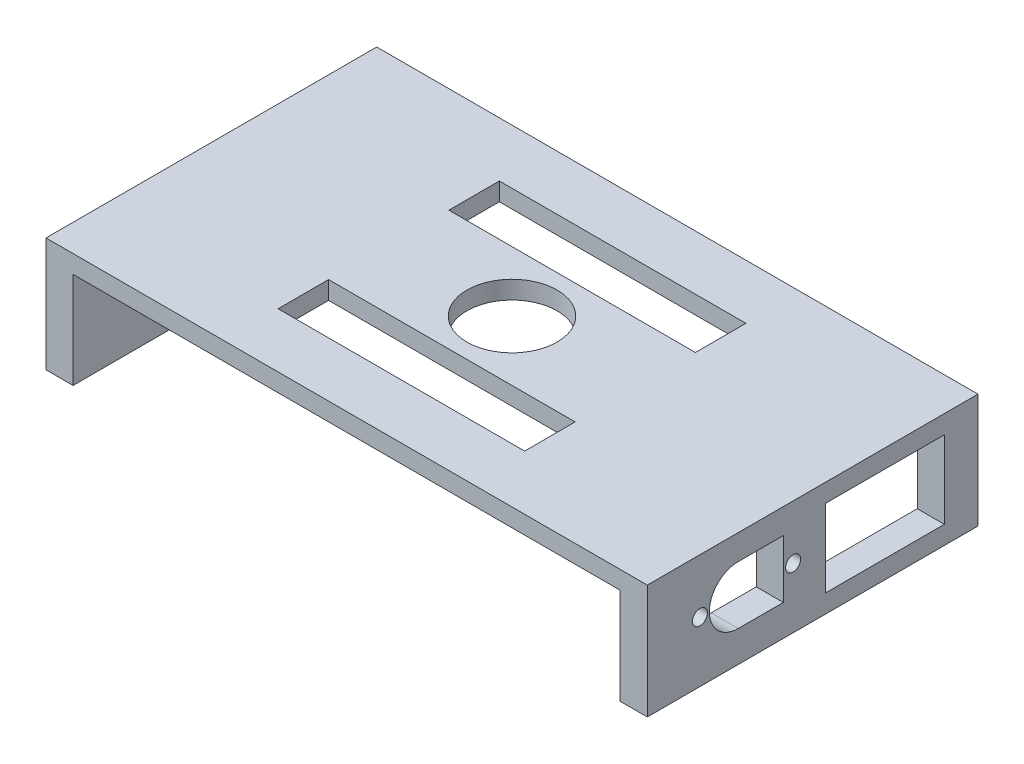
from build123d import *

# Parameters (mm, degrees)
SKETCH1_W           = 100
SKETCH1_H           = 55
BOSS_EXTRUDE1_DEPTH = 19
SKETCH2_W           = 91
SKETCH2_H           = 91
CUT_EXTRUDE1_DEPTH  = 16
CUT_EXTRUDE3_REACH  = 107.438
SKETCH3_R           = 1.25
CUT_EXTRUDE13_REACH = 107.438
SKETCH15_W          = 19.8
SKETCH15_H          = 12.9
CUT_EXTRUDE14_REACH = 62.144
SKETCH6_R           = 7.5
SKETCH6_W           = 41
SKETCH6_H           = 8.4


with BuildPart() as part:
    # Sketch1 → Boss-Extrude1 (new body)
    with BuildSketch(Plane(origin=(0, 0, 0), x_dir=(1, 0, 0), z_dir=(0, 1, 0))):
        Rectangle(SKETCH1_W, SKETCH1_H)
    extrude(amount=BOSS_EXTRUDE1_DEPTH)

    # Sketch2 → Cut-Extrude1 (cut)
    with BuildSketch(Plane.XZ):
        Rectangle(SKETCH2_W, SKETCH2_H)
    extrude(amount=-CUT_EXTRUDE1_DEPTH, mode=Mode.SUBTRACT)

    # Sketch3 → Cut-Extrude3 (cut, up to next)
    with BuildSketch(Plane(origin=(50, 0, 0), x_dir=(0, 0, -1), z_dir=(1, 0, 0)), mode=Mode.PRIVATE) as cut_extrude3_sk1:
        with Locations((-18.75, 10)):
            Circle(SKETCH3_R)
    cut_extrude3_tool1 = extrude(cut_extrude3_sk1.sketch, amount=-CUT_EXTRUDE3_REACH, mode=Mode.PRIVATE) & part.part
    # Sketch3 → Cut-Extrude3 (cut, up to next)
    with BuildSketch(Plane(origin=(50, 0, 0), x_dir=(0, 0, -1), z_dir=(1, 0, 0)), mode=Mode.PRIVATE) as cut_extrude3_sk2:
        with Locations((-3.25, 10)):
            Circle(SKETCH3_R)
    cut_extrude3_tool2 = extrude(cut_extrude3_sk2.sketch, amount=-CUT_EXTRUDE3_REACH, mode=Mode.PRIVATE) & part.part
    # Sketch3 → Cut-Extrude3 (cut, up to next)
    with BuildSketch(Plane(origin=(50, 0, 0), x_dir=(0, 0, -1), z_dir=(1, 0, 0)), mode=Mode.PRIVATE) as cut_extrude3_sk3:
        with BuildLine():
            Line((-4.871818182, 5.185), (-4.871818182, 14.815))
            Line((-4.871818182, 14.815), (-12.367897727, 14.815))
            ThreePointArc((-12.367897727, 14.815), (-17.182897727, 10), (-12.367897727, 5.185))
            Line((-12.367897727, 5.185), (-4.871818182, 5.185))
        make_face()
    cut_extrude3_tool3 = extrude(cut_extrude3_sk3.sketch, amount=-CUT_EXTRUDE3_REACH, mode=Mode.PRIVATE) & part.part
    add(cut_extrude3_tool1.solids().sort_by_distance((50, 10, 18.75))[0], mode=Mode.SUBTRACT)
    add(cut_extrude3_tool2.solids().sort_by_distance((50, 10, 3.25))[0], mode=Mode.SUBTRACT)
    add(cut_extrude3_tool3.solids().sort_by_distance((50, 10, 10.561909))[0], mode=Mode.SUBTRACT)

    # Sketch15 → Cut-Extrude13 (cut, up to next)
    with BuildSketch(Plane(origin=(50, 0, 0), x_dir=(0, 0, -1), z_dir=(1, 0, 0)), mode=Mode.PRIVATE) as cut_extrude13_sk1:
        with Locations((12, 9.5)):
            Rectangle(SKETCH15_W, SKETCH15_H)
    cut_extrude13_tool1 = extrude(cut_extrude13_sk1.sketch, amount=-CUT_EXTRUDE13_REACH, mode=Mode.PRIVATE) & part.part
    add(cut_extrude13_tool1.solids().sort_by_distance((50, 9.5, -12))[0], mode=Mode.SUBTRACT)

    # Sketch6 → Cut-Extrude14 (cut, up to next)
    with BuildSketch(Plane(origin=(0, 19, 0), x_dir=(1, 0, 0), z_dir=(0, 1, 0)), mode=Mode.PRIVATE) as cut_extrude14_sk1:
        Circle(SKETCH6_R)
    cut_extrude14_tool1 = extrude(cut_extrude14_sk1.sketch, amount=-CUT_EXTRUDE14_REACH, mode=Mode.PRIVATE) & part.part
    # Sketch6 → Cut-Extrude14 (cut, up to next)
    with BuildSketch(Plane(origin=(0, 19, 0), x_dir=(1, 0, 0), z_dir=(0, 1, 0)), mode=Mode.PRIVATE) as cut_extrude14_sk2:
        with Locations((0, -14.2)):
            Rectangle(SKETCH6_W, SKETCH6_H)
    cut_extrude14_tool2 = extrude(cut_extrude14_sk2.sketch, amount=-CUT_EXTRUDE14_REACH, mode=Mode.PRIVATE) & part.part
    # Sketch6 → Cut-Extrude14 (cut, up to next)
    with BuildSketch(Plane(origin=(0, 19, 0), x_dir=(1, 0, 0), z_dir=(0, 1, 0)), mode=Mode.PRIVATE) as cut_extrude14_sk3:
        with Locations((0, 14.2)):
            Rectangle(SKETCH6_W, SKETCH6_H)
    cut_extrude14_tool3 = extrude(cut_extrude14_sk3.sketch, amount=-CUT_EXTRUDE14_REACH, mode=Mode.PRIVATE) & part.part
    add(cut_extrude14_tool1.solids().sort_by_distance((0, 19, 0))[0], mode=Mode.SUBTRACT)
    add(cut_extrude14_tool2.solids().sort_by_distance((0, 19, 14.2))[0], mode=Mode.SUBTRACT)
    add(cut_extrude14_tool3.solids().sort_by_distance((0, 19, -14.2))[0], mode=Mode.SUBTRACT)


solid = part.part
